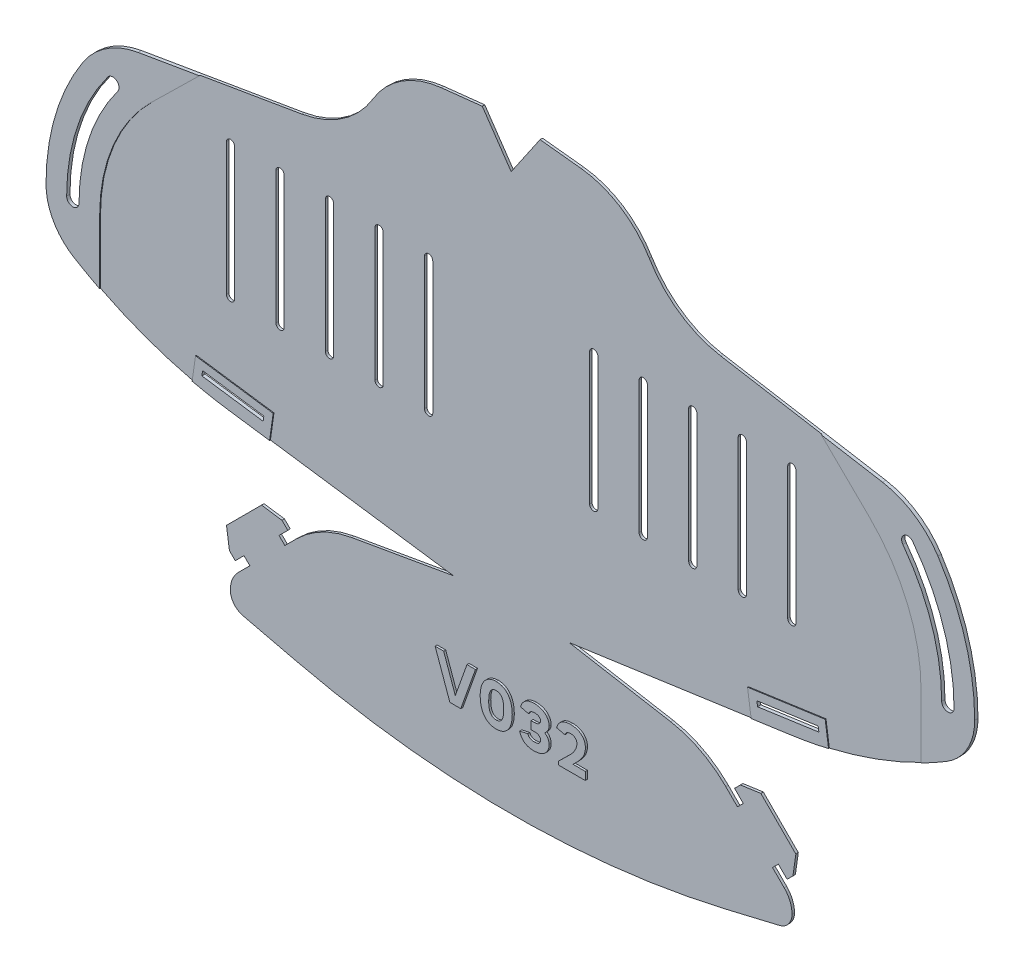
from build123d import *

# Parameters (mm, degrees)
MAIN_SHAPE_DEPTH                   = 0.6
ELASTIC_ATTACHMENT_POINTS_DEPTH    = 184.525502315
REINFORCED_ATTACHMENT_POINTS_DEPTH = 0.2
TAB_SLITS_DEPTH                    = 184.525502315
REINFORCED_TAB_SLITS_DEPTH         = 0.2
BREATHING_SLITS_DEPTH              = 184.525502315
VERSION_NUMBER_DEPTH               = 0.5


with BuildPart() as part:
    # Sketch1 → Main Shape (new body)
    with BuildSketch(Plane.XY):
        with BuildLine():
            Line((0, -10.235233266), (-7, 0))
            Line((-7, 0), (-16.941855461, -1.076805455))
            ThreePointArc((-16.941855461, -1.076805455), (-26.448172688, -4.42923559), (-33.461443341, -11.669600897))
            ThreePointArc((-33.461443341, -11.669600897), (-40.804108255, -19.481824954), (-50.74391922, -23.5))
            Line((-50.74391922, -23.5), (-90.180351554, -30.190874742))
            ThreePointArc((-90.180351554, -30.190874742), (-97.811505455, -33.190405434), (-103.597722286, -39))
            ThreePointArc((-103.597722286, -39), (-110.227482046, -53.35351039), (-112.5, -69))
            ThreePointArc((-112.5, -69), (-110.685143325, -75.893640703), (-105.711102551, -81))
            ThreePointArc((-105.711102551, -81), (-87.655491519, -89.524485559), (-68.266232563, -94.291935705))
            Line((-68.266232563, -94.291935705), (-14, -102))
            Line((-14, -102), (-38.626554922, -106.304973016))
            ThreePointArc((-38.626554922, -106.304973016), (-45.849449199, -108.748014338), (-52, -113.254607005))
            Line((-52, -113.254607005), (-54.828307349, -116.0831539))
            Line((-54.828307349, -116.0831539), (-56.242580797, -114.669000226))
            Line((-56.242580797, -114.669000226), (-54.121350285, -112.547590054))
            Line((-54.121350285, -112.547590054), (-55.535623732, -111.13343638))
            Line((-55.535623732, -111.13343638), (-60.48540114, -110.426539202))
            Line((-60.48540114, -110.426539202), (-68.970323187, -118.912179887))
            Line((-68.970323187, -118.912179887), (-68.263006804, -123.861897408))
            Line((-68.263006804, -123.861897408), (-66.848733357, -125.276051082))
            Line((-66.848733357, -125.276051082), (-64.727502845, -123.154640911))
            Line((-64.727502845, -123.154640911), (-63.313229397, -124.568794586))
            Line((-63.313229397, -124.568794586), (-66.141536747, -127.397341481))
            ThreePointArc((-66.141536747, -127.397341481), (-67.550417669, -129.506025763), (-68.045148042, -131.993340924))
            ThreePointArc((-68.045148042, -131.993340924), (-67.183295285, -134.473669911), (-64.9691321, -135.885159709))
            Line((-64.9691321, -135.885159709), (-52.436095294, -138.860716087))
            ThreePointArc((-52.436095294, -138.860716087), (-26.397134772, -143.459954927), (0, -145))
            ThreePointArc((0, -145), (26.397134772, -143.459954927), (52.436095294, -138.860716087))
            Line((52.436095294, -138.860716087), (64.9691321, -135.885159709))
            ThreePointArc((64.9691321, -135.885159709), (67.183295285, -134.473669911), (68.045148042, -131.993340924))
            ThreePointArc((68.045148042, -131.993340924), (67.550417669, -129.506025763), (66.141536747, -127.397341481))
            Line((66.141536747, -127.397341481), (63.313229397, -124.568794586))
            Line((63.313229397, -124.568794586), (64.727502845, -123.154640911))
            Line((64.727502845, -123.154640911), (66.848733357, -125.276051082))
            Line((66.848733357, -125.276051082), (68.263006804, -123.861897408))
            Line((68.263006804, -123.861897408), (68.970323187, -118.912179887))
            Line((68.970323187, -118.912179887), (60.48540114, -110.426539202))
            Line((60.48540114, -110.426539202), (55.535623732, -111.13343638))
            Line((55.535623732, -111.13343638), (54.121350285, -112.547590054))
            Line((54.121350285, -112.547590054), (56.242580797, -114.669000226))
            Line((56.242580797, -114.669000226), (54.828307349, -116.0831539))
            Line((54.828307349, -116.0831539), (52, -113.254607005))
            ThreePointArc((52, -113.254607005), (45.849449199, -108.748014338), (38.626554922, -106.304973016))
            Line((38.626554922, -106.304973016), (14, -102))
            Line((14, -102), (68.266232563, -94.291935705))
            ThreePointArc((68.266232563, -94.291935705), (87.655491519, -89.524485559), (105.711102551, -81))
            ThreePointArc((105.711102551, -81), (110.685143325, -75.893640703), (112.5, -69))
            ThreePointArc((112.5, -69), (110.227482046, -53.35351039), (103.597722286, -39))
            ThreePointArc((103.597722286, -39), (97.811505455, -33.190405434), (90.180351554, -30.190874742))
            Line((90.180351554, -30.190874742), (50.74391922, -23.5))
            ThreePointArc((50.74391922, -23.5), (40.804108255, -19.481824954), (33.461443341, -11.669600897))
            ThreePointArc((33.461443341, -11.669600897), (26.448172688, -4.42923559), (16.941855461, -1.076805455))
            Line((16.941855461, -1.076805455), (7, 0))
            Line((7, 0), (0, -10.235233266))
        make_face()
    extrude(amount=MAIN_SHAPE_DEPTH)

    # Sketch2 → Elastic Attachment Points (cut, through all)
    with BuildSketch(Plane.XY.offset(0.6)):
        with BuildLine():
            ThreePointArc((-97.5, -39), (-104.934164903, -53.188611699), (-107.5, -69))
            ThreePointArc((-107.5, -69), (-106, -70.5), (-104.5, -69))
            ThreePointArc((-104.5, -69), (-102.088115008, -54.137294997), (-95.1, -40.8))
            ThreePointArc((-95.1, -40.8), (-95.4, -38.7), (-97.5, -39))
        make_face()
        with BuildLine():
            ThreePointArc((97.5, -39), (104.934164903, -53.188611699), (107.5, -69))
            ThreePointArc((107.5, -69), (106, -70.5), (104.5, -69))
            ThreePointArc((104.5, -69), (102.088115008, -54.137294997), (95.1, -40.8))
            ThreePointArc((95.1, -40.8), (95.4, -38.7), (97.5, -39))
        make_face()
    extrude(amount=-ELASTIC_ATTACHMENT_POINTS_DEPTH, mode=Mode.SUBTRACT)

    # Sketch7 → Reinforced Attachment Points (add)
    # profile 1 of 2: a face of its own
    with BuildSketch(Plane.XY.offset(0.6)):
        with BuildLine():
            Line((-99.5, -69), (-99.5, -84.438405623))
            ThreePointArc((-99.5, -84.438405623), (-102.636073846, -82.774338486), (-105.711102551, -81))
            ThreePointArc((-105.711102551, -81), (-110.685143325, -75.893640703), (-112.5, -69))
            ThreePointArc((-112.5, -69), (-110.227482046, -53.35351039), (-103.597722286, -39))
            ThreePointArc((-103.597722286, -39), (-97.811505455, -33.190405434), (-90.180351554, -30.190874742))
            Line((-90.180351554, -30.190874742), (-75.331937335, -27.671659038))
            Line((-75.331937335, -27.671659038), (-86.893876913, -39))
            ThreePointArc((-86.893876913, -39), (-96.22042633, -52.729517991), (-99.5, -69))
        make_face()
        with BuildLine():
            ThreePointArc((-107.5, -69), (-106, -70.5), (-104.5, -69))
            ThreePointArc((-104.5, -69), (-102.088115008, -54.137294997), (-95.1, -40.8))
            ThreePointArc((-95.1, -40.8), (-95.4, -38.7), (-97.5, -39))
            ThreePointArc((-97.5, -39), (-104.934164903, -53.188611699), (-107.5, -69))
        make_face(mode=Mode.SUBTRACT)
    # profile 2 of 2: a face of its own
    with BuildSketch(Plane.XY.offset(0.6)):
        with BuildLine():
            Line((75.331937335, -27.671659038), (90.180351554, -30.190874742))
            ThreePointArc((90.180351554, -30.190874742), (97.811505455, -33.190405434), (103.597722286, -39))
            ThreePointArc((103.597722286, -39), (110.227482046, -53.35351039), (112.5, -69))
            ThreePointArc((112.5, -69), (110.685143325, -75.893640703), (105.711102551, -81))
            ThreePointArc((105.711102551, -81), (102.636073846, -82.774338486), (99.5, -84.438405623))
            Line((99.5, -84.438405623), (99.5, -69))
            ThreePointArc((99.5, -69), (96.22042633, -52.729517991), (86.893876913, -39))
            Line((86.893876913, -39), (75.331937335, -27.671659038))
        make_face()
        with BuildLine():
            ThreePointArc((104.5, -69), (106, -70.5), (107.5, -69))
            ThreePointArc((107.5, -69), (104.934164903, -53.188611699), (97.5, -39))
            ThreePointArc((97.5, -39), (95.4, -38.7), (95.1, -40.8))
            ThreePointArc((95.1, -40.8), (102.088115008, -54.137294997), (104.5, -69))
        make_face(mode=Mode.SUBTRACT)
    extrude(amount=REINFORCED_ATTACHMENT_POINTS_DEPTH)

    # Sketch6 → Tab Slits (cut, through all)
    with BuildSketch(Plane.XY.offset(0.6)):
        Polygon((-74.744153432, -90.341688636), (-59.893220219, -92.451139443), (-59.724464154, -91.263064785), (-74.575397367, -89.153613979), align=None)
        Polygon((74.744153432, -90.341688636), (74.575397367, -89.153613979), (59.724464154, -91.263064785), (59.893220219, -92.451139443), align=None)
    extrude(amount=-TAB_SLITS_DEPTH, mode=Mode.SUBTRACT)

    # Sketch9 → Reinforced Tab Slits (add)
    # profile 1 of 2: a face of its own
    with BuildSketch(Plane.XY.offset(0.6)):
        with BuildLine():
            Line((-58.334985952, -95.702586193), (-57.463079618, -89.564200465))
            Line((-57.463079618, -89.564200465), (-76.274261688, -86.892229443))
            Line((-76.274261688, -86.892229443), (-77.089489456, -92.631587333))
            ThreePointArc((-77.089489456, -92.631587333), (-72.696503913, -93.560831767), (-68.266232563, -94.291935705))
            Line((-68.266232563, -94.291935705), (-58.334985952, -95.702586193))
        make_face()
        Polygon((-59.893220219, -92.451139443), (-59.724464154, -91.263064785), (-74.575397367, -89.153613979), (-74.744153432, -90.341688636), align=None, mode=Mode.SUBTRACT)
    # profile 2 of 2: a face of its own
    with BuildSketch(Plane.XY.offset(0.6)):
        with BuildLine():
            Line((68.266232563, -94.291935705), (58.334985952, -95.702586193))
            Line((58.334985952, -95.702586193), (57.463079618, -89.564200465))
            Line((57.463079618, -89.564200465), (76.274261688, -86.892229443))
            Line((76.274261688, -86.892229443), (77.089489456, -92.631587333))
            ThreePointArc((77.089489456, -92.631587333), (72.696503913, -93.560831767), (68.266232563, -94.291935705))
        make_face()
        Polygon((59.724464154, -91.263064785), (74.575397367, -89.153613979), (74.744153432, -90.341688636), (59.893220219, -92.451139443), align=None, mode=Mode.SUBTRACT)
    extrude(amount=REINFORCED_TAB_SLITS_DEPTH)

    # Sketch3 → Breathing Slits (cut, through all)
    with BuildSketch(Plane.XY.offset(0.6)):
        with BuildLine():
            Line((-19, -38.45), (-19, -70.45))
            ThreePointArc((-19, -70.45), (-20, -71.45), (-21, -70.45))
            Line((-21, -70.45), (-21, -38.45))
            ThreePointArc((-21, -38.45), (-20, -37.45), (-19, -38.45))
        make_face()
        with BuildLine():
            Line((-31, -38.45), (-31, -70.45))
            ThreePointArc((-31, -70.45), (-32, -71.45), (-33, -70.45))
            Line((-33, -70.45), (-33, -38.45))
            ThreePointArc((-33, -38.45), (-32, -37.45), (-31, -38.45))
        make_face()
        with BuildLine():
            Line((-43, -38.45), (-43, -70.45))
            ThreePointArc((-43, -70.45), (-44, -71.45), (-45, -70.45))
            Line((-45, -70.45), (-45, -38.45))
            ThreePointArc((-45, -38.45), (-44, -37.45), (-43, -38.45))
        make_face()
        with BuildLine():
            Line((-55, -38.45), (-55, -70.45))
            ThreePointArc((-55, -70.45), (-56, -71.45), (-57, -70.45))
            Line((-57, -70.45), (-57, -38.45))
            ThreePointArc((-57, -38.45), (-56, -37.45), (-55, -38.45))
        make_face()
        with BuildLine():
            Line((-67, -38.45), (-67, -70.45))
            ThreePointArc((-67, -70.45), (-68, -71.45), (-69, -70.45))
            Line((-69, -70.45), (-69, -38.45))
            ThreePointArc((-69, -38.45), (-68, -37.45), (-67, -38.45))
        make_face()
        with BuildLine():
            Line((19, -38.45), (19, -70.45))
            ThreePointArc((19, -70.45), (20, -71.45), (21, -70.45))
            Line((21, -70.45), (21, -38.45))
            ThreePointArc((21, -38.45), (20, -37.45), (19, -38.45))
        make_face()
        with BuildLine():
            Line((31, -38.45), (31, -70.45))
            ThreePointArc((31, -70.45), (32, -71.45), (33, -70.45))
            Line((33, -70.45), (33, -38.45))
            ThreePointArc((33, -38.45), (32, -37.45), (31, -38.45))
        make_face()
        with BuildLine():
            Line((43, -38.45), (43, -70.45))
            ThreePointArc((43, -70.45), (44, -71.45), (45, -70.45))
            Line((45, -70.45), (45, -38.45))
            ThreePointArc((45, -38.45), (44, -37.45), (43, -38.45))
        make_face()
        with BuildLine():
            Line((55, -38.45), (55, -70.45))
            ThreePointArc((55, -70.45), (56, -71.45), (57, -70.45))
            Line((57, -70.45), (57, -38.45))
            ThreePointArc((57, -38.45), (56, -37.45), (55, -38.45))
        make_face()
        with BuildLine():
            Line((67, -38.45), (67, -70.45))
            ThreePointArc((67, -70.45), (68, -71.45), (69, -70.45))
            Line((69, -70.45), (69, -38.45))
            ThreePointArc((69, -38.45), (68, -37.45), (67, -38.45))
        make_face()
    extrude(amount=-BREATHING_SLITS_DEPTH, mode=Mode.SUBTRACT)

    # Sketch8 → Version Number (add)
    # profile 1 of 4: a face of its own
    with BuildSketch(Plane.XY.offset(0.6)):
        Polygon((-14.353036684, -128.5), (-11.718116049, -128.5), (-8.146687478, -118.5), (-10.210179541, -118.5), (-13.035576367, -126.420634921), (-15.860973192, -118.5), (-17.924465256, -118.5), align=None)
    # profile 2 of 4: a face of its own
    with BuildSketch(Plane.XY.offset(0.6)):
        with BuildLine():
            add(Edge.make_bspline(
                [(-3.124512798, -118.5), (-3.268878762, -118.505695671), (-3.55163391, -118.51685121), (-3.964768911, -118.5745591), (-4.352611614, -118.680335178), (-4.71981319, -118.819656178), (-5.062088761, -119.003303471), (-5.385881936, -119.221085059), (-5.678892551, -119.487440084), (-5.954347604, -119.785519386), (-6.200210785, -120.12453761), (-6.413646494, -120.500892889), (-6.595609271, -120.912503383), (-6.744530434, -121.360169436), (-6.860079483, -121.844506854), (-6.947833422, -122.364485904), (-6.999387861, -122.921030718), (-7.010044591, -123.303893775), (-7.015523173, -123.500722112)],
                knots=[0, 0, 0, 0, 0.970159994, 1.900155169, 2.79438565, 3.665191596, 4.532301255, 5.397946305, 6.279238358, 7.185391655, 8.120220805, 9.085107467, 10.08639026, 11.138349125, 12.249459105, 13.427760297, 14.677622047, 16, 16, 16, 16], degree=3))
            add(Edge.make_bspline(
                [(-7.015523173, -123.500722112), (-7.010099782, -123.69832053), (-6.999591155, -124.081196856), (-6.947624086, -124.637697099), (-6.860178196, -125.156966907), (-6.744068339, -125.641884177), (-6.596125676, -126.090648826), (-6.413579051, -126.502814664), (-6.200268747, -126.879260377), (-5.954187566, -127.218032326), (-5.679795829, -127.51659595), (-5.384328283, -127.779877259), (-5.06297704, -128.000979952), (-4.719619736, -128.183632701), (-4.353066681, -128.324409639), (-3.964113602, -128.425104033), (-3.552335281, -128.488808035), (-3.269553908, -128.496221224), (-3.125409832, -128.5)],
                knots=[0, 0, 0, 0, 1.327400251, 2.57203543, 3.750234214, 4.861247624, 5.917991082, 6.919186852, 7.883989653, 8.818737555, 9.724812096, 10.602616666, 11.47109776, 12.338132057, 13.208862319, 14.101698703, 15.032365954, 16, 16, 16, 16], degree=3))
            add(Edge.make_bspline(
                [(-3.125409832, -128.5), (-2.981270164, -128.496210687), (-2.698497434, -128.488776824), (-2.28665702, -128.425221319), (-1.897234689, -128.323813307), (-1.529873211, -128.184839888), (-1.187483731, -128.000200623), (-0.866437325, -127.779984633), (-0.571038656, -127.516566079), (-0.296628857, -127.218040576), (-0.05054823, -126.879258594), (0.162744512, -126.502813072), (0.345366389, -126.090657611), (0.493004127, -125.641847927), (0.610316977, -125.157235462), (0.692759124, -124.637275213), (0.750415349, -124.081441513), (0.758325717, -123.698369528), (0.762407101, -123.500722112)],
                knots=[0, 0, 0, 0, 0.96765053, 1.898333634, 2.791185227, 3.666728435, 4.529238626, 5.397734515, 6.275554038, 7.181644014, 8.116407839, 9.081227075, 10.082439899, 11.139201358, 12.250233695, 13.427610983, 14.672766316, 16, 16, 16, 16], degree=3))
            add(Edge.make_bspline(
                [(0.762407101, -123.500722112), (0.758266271, -123.303845261), (0.750209566, -122.920787111), (0.692965588, -122.364907693), (0.610217393, -121.844238468), (0.493467757, -121.360205444), (0.344849792, -120.912494629), (0.162811975, -120.500894477), (-0.050606202, -120.124539393), (-0.296468797, -119.785511139), (-0.571942034, -119.487469991), (-0.864883242, -119.220977415), (-1.188368104, -119.004075275), (-1.529679752, -118.818455332), (-1.897690316, -118.680915067), (-2.286006948, -118.574534625), (-2.698856026, -118.516562336), (-2.981340857, -118.506550382), (-3.125409832, -118.501444225)],
                knots=[0, 0, 0, 0, 1.322391154, 2.572941942, 3.750582404, 4.861863084, 5.913983562, 6.915420183, 7.880455081, 8.815427849, 9.721720359, 10.603147806, 11.468925845, 12.331628829, 13.207367743, 14.101735605, 15.031873656, 16, 16, 16, 16], degree=3))
            Line((-3.125409832, -118.501444225), (-3.124512798, -118.5))
        make_face()
        with BuildLine():
            add(Edge.make_bspline(
                [(-3.124512798, -126.579365079), (-3.193832346, -126.580142247), (-3.329842672, -126.581667111), (-3.527295909, -126.549518886), (-3.713747004, -126.50001124), (-3.887924299, -126.424863461), (-4.05171966, -126.32888552), (-4.202335203, -126.207295998), (-4.340694226, -126.063513987), (-4.468009284, -125.896932623), (-4.581880587, -125.703005633), (-4.680411576, -125.478827118), (-4.761148991, -125.222713054), (-4.830325749, -124.937433189), (-4.881577114, -124.621763618), (-4.920080679, -124.276117752), (-4.945947343, -123.899148475), (-4.949306618, -123.63702081), (-4.951053342, -123.500722112)],
                knots=[0, 0, 0, 0, 0.820209436, 1.609314487, 2.362064528, 3.101854642, 3.850272983, 4.605479342, 5.3882482, 6.210255141, 7.084711649, 8.047345167, 9.106040688, 10.263495908, 11.523832392, 12.893430008, 14.384674726, 16, 16, 16, 16], degree=3))
            add(Edge.make_bspline(
                [(-4.951053342, -123.500722112), (-4.949299731, -123.364424703), (-4.945927212, -123.102299516), (-4.920151567, -122.725313211), (-4.881258593, -122.378974061), (-4.830962309, -122.063111109), (-4.760744886, -121.778059679), (-4.680441854, -121.522619394), (-4.581911694, -121.298401339), (-4.467877035, -121.104640769), (-4.341486731, -120.937923887), (-4.201524245, -120.796456824), (-4.051803493, -120.674830172), (-3.887963609, -120.578630118), (-3.713317589, -120.50465551), (-3.527950042, -120.450210023), (-3.329806333, -120.423926373), (-3.19436306, -120.422146526), (-3.125409832, -120.421240419)],
                knots=[0, 0, 0, 0, 1.616177311, 3.108208617, 4.478528655, 5.748482895, 6.897727805, 7.956981757, 8.920123036, 9.795040793, 10.617481319, 11.394165711, 12.149770419, 12.898583529, 13.63876386, 14.394368568, 15.182584207, 16, 16, 16, 16], degree=3))
            add(Edge.make_bspline(
                [(-3.125409832, -120.421240419), (-3.056458197, -120.422149219), (-2.921018053, -120.423934355), (-2.722851832, -120.450179948), (-2.537565245, -120.504762296), (-2.363231898, -120.577982734), (-2.201006563, -120.675595023), (-2.051536805, -120.796360516), (-1.911636558, -120.937948802), (-1.785272246, -121.104645093), (-1.671047509, -121.298351736), (-1.573262228, -121.523063414), (-1.48930237, -121.777554553), (-1.420113271, -122.063195246), (-1.369483592, -122.378948588), (-1.330691478, -122.725320897), (-1.304885814, -123.102297333), (-1.301517662, -123.364423957), (-1.299766323, -123.500722112)],
                knots=[0, 0, 0, 0, 0.817669415, 1.606129616, 2.361968767, 3.102378757, 3.843623451, 4.599462602, 5.376387978, 6.199083685, 7.074272906, 8.037713021, 9.100132017, 10.249733507, 11.520081779, 12.89082699, 14.383321233, 16, 16, 16, 16], degree=3))
            add(Edge.make_bspline(
                [(-1.299766323, -123.500722112), (-1.301510776, -123.637021556), (-1.304865684, -123.899150658), (-1.33076236, -124.276110066), (-1.36916531, -124.621789015), (-1.420748529, -124.937349474), (-1.488890394, -125.223220708), (-1.573291906, -125.478383327), (-1.671078761, -125.703055181), (-1.78513994, -125.896928348), (-1.912429082, -126.063488884), (-2.050725173, -126.207393621), (-2.201089262, -126.328120602), (-2.363270489, -126.425517476), (-2.537135739, -126.499891817), (-2.723505077, -126.549600883), (-2.920694706, -126.581404352), (-3.056393241, -126.580608552), (-3.125409832, -126.580203806)],
                knots=[0, 0, 0, 0, 1.616177474, 3.108208932, 4.478529109, 5.739530511, 6.897596372, 7.959685938, 8.922827315, 9.797745161, 10.620185771, 11.403367596, 12.15897238, 12.899987232, 13.640167639, 14.39331481, 15.182836171, 16, 16, 16, 16], degree=3))
            Line((-3.125409832, -126.580203806), (-3.124512798, -126.579365079))
        make_face(mode=Mode.SUBTRACT)
    # profile 3 of 4: a face of its own
    with BuildSketch(Plane.XY.offset(0.6)):
        with BuildLine():
            Line((6.198092009, -124.404761905), (6.293330104, -124.404761905))
            add(Edge.make_bspline(
                [(6.293330104, -124.404761905), (6.393597999, -124.411299477), (6.584233201, -124.423729091), (6.850899497, -124.486416557), (7.083693586, -124.578961335), (7.275380964, -124.709274647), (7.429026265, -124.861365804), (7.543353704, -125.032278467), (7.613014948, -125.222537651), (7.621890385, -125.355662585), (7.626367416, -125.422814713)],
                knots=[0, 0, 0, 0, 1.293250512, 2.458803691, 3.516087315, 4.504014474, 5.424976382, 6.287022232, 7.135923681, 8, 8, 8, 8], degree=3))
            add(Edge.make_bspline(
                [(7.626367416, -125.422814713), (7.623077866, -125.504440638), (7.61671688, -125.662280257), (7.547569508, -125.887718235), (7.429214651, -126.087113891), (7.294298814, -126.23073656), (7.165134159, -126.331172702), (7.050245163, -126.395688771), (6.921394263, -126.450185226), (6.778366257, -126.49595932), (6.621644798, -126.532200484), (6.450685861, -126.560253509), (6.264862139, -126.575366879), (6.136023143, -126.5785552), (6.069403517, -126.580203806)],
                knots=[0, 0, 0, 0, 1.334208421, 2.579951764, 3.816761299, 5.103436918, 5.78324123, 6.491044783, 7.25516555, 8.072210043, 8.94833879, 9.888551629, 10.908219533, 12, 12, 12, 12], degree=3))
            add(Edge.make_bspline(
                [(6.069403517, -126.580203806), (5.995009926, -126.579024673), (5.844525333, -126.576639503), (5.617878787, -126.537785365), (5.389603829, -126.472292557), (5.16250643, -126.384048723), (4.948349829, -126.26078738), (4.771027301, -126.088542309), (4.629857545, -125.87591894), (4.575288391, -125.712337396), (4.546885722, -125.62719493)],
                knots=[0, 0, 0, 0, 0.920255672, 1.861508472, 2.836752399, 3.857684402, 4.873720033, 5.872631744, 6.892727297, 8, 8, 8, 8], degree=3))
            Line((4.546885722, -125.62719493), (2.563171374, -126.071428571))
            add(Edge.make_bspline(
                [(2.563171374, -126.071428571), (2.586006658, -126.160336196), (2.630962803, -126.335369884), (2.723971682, -126.586847228), (2.83540912, -126.824009097), (2.960565463, -127.050933458), (3.10871655, -127.26169635), (3.272885089, -127.459934114), (3.452116619, -127.647890635), (3.652448911, -127.819546753), (3.86989589, -127.976110236), (4.107042463, -128.112422888), (4.361607961, -128.230322428), (4.637145351, -128.322934743), (4.929262966, -128.399729339), (5.240531536, -128.45295857), (5.569362514, -128.491934936), (5.795244006, -128.497268097), (5.910951439, -128.5)],
                knots=[0, 0, 0, 0, 0.97897001, 1.927311989, 2.855460552, 3.773345826, 4.68872018, 5.599601379, 6.518067916, 7.456260856, 8.41049365, 9.372940738, 10.370680865, 11.39871829, 12.470472684, 13.590411754, 14.765692276, 16, 16, 16, 16], degree=3))
            add(Edge.make_bspline(
                [(5.910951439, -128.5), (6.067221325, -128.494245394), (6.369747375, -128.483104934), (6.807556164, -128.435865678), (7.213204546, -128.358387224), (7.586979338, -128.252017359), (7.931853032, -128.123277608), (8.242838452, -127.961059217), (8.524929888, -127.774497038), (8.772583909, -127.55815064), (8.986978622, -127.319870658), (9.178736196, -127.071551477), (9.336525488, -126.805353082), (9.469056142, -126.527874631), (9.567683766, -126.234513517), (9.639147469, -125.928607165), (9.680819871, -125.607680152), (9.685937504, -125.38925418), (9.68854084, -125.278141077)],
                knots=[0, 0, 0, 0, 1.338573179, 2.591371041, 3.766159492, 4.869841347, 5.915366975, 6.911991706, 7.866279139, 8.804635322, 9.718527085, 10.607232931, 11.486170613, 12.362759498, 13.235296616, 14.130311397, 15.048891017, 16, 16, 16, 16], degree=3))
            add(Edge.make_bspline(
                [(9.68854084, -125.278141077), (9.683192413, -125.181448476), (9.672665654, -124.991138356), (9.617350068, -124.713321084), (9.52499018, -124.451246621), (9.395798442, -124.20784025), (9.244598736, -123.977552327), (9.06946732, -123.764837772), (8.875070274, -123.566155092), (8.730645608, -123.449574998), (8.657454128, -123.39049458)],
                knots=[0, 0, 0, 0, 1.042147361, 2.051151675, 3.039496243, 4.024119517, 5.012016893, 6.002285516, 6.987598979, 8, 8, 8, 8], degree=3))
            add(Edge.make_bspline(
                [(8.657454128, -123.39049458), (8.730635163, -123.325162044), (8.874995919, -123.19628365), (9.069268042, -122.981710509), (9.243438747, -122.755542958), (9.396794499, -122.515248899), (9.523996024, -122.261642739), (9.616820113, -121.993228321), (9.672728376, -121.711764564), (9.683213764, -121.519933272), (9.68854084, -121.42247384)],
                knots=[0, 0, 0, 0, 1.026734164, 2.025389794, 3.025877614, 4.013273499, 5.006315215, 5.989929209, 6.978788314, 8, 8, 8, 8], degree=3))
            add(Edge.make_bspline(
                [(9.68854084, -121.42247384), (9.684458975, -121.322020203), (9.676439995, -121.124675201), (9.629497298, -120.835115028), (9.554319283, -120.558271626), (9.446877226, -120.294880847), (9.31346163, -120.042407113), (9.148649716, -119.803370965), (8.957620538, -119.574583887), (8.736789679, -119.361344215), (8.490090521, -119.166999953), (8.218282305, -118.995833154), (7.923743615, -118.84746887), (7.602967562, -118.730513446), (7.261051945, -118.632405283), (6.895172109, -118.562780212), (6.506096954, -118.515976725), (6.238708863, -118.506371293), (6.101553214, -118.501444225)],
                knots=[0, 0, 0, 0, 0.933249724, 1.833404674, 2.71837752, 3.592513965, 4.4704886, 5.365912677, 6.284554944, 7.234984132, 8.212272519, 9.196674926, 10.214289296, 11.269589965, 12.363543901, 13.515449053, 14.72555956, 16, 16, 16, 16], degree=3))
            add(Edge.make_bspline(
                [(6.101553214, -118.501444225), (5.988160862, -118.504384419), (5.766980103, -118.510119502), (5.444195833, -118.546209564), (5.138366528, -118.597359567), (4.849547802, -118.671164203), (4.578504245, -118.76520159), (4.324782162, -118.877770477), (4.088252628, -119.009217236), (3.870649359, -119.161041577), (3.670388783, -119.328960798), (3.488991795, -119.510905494), (3.324244802, -119.704452098), (3.179710626, -119.91288512), (3.05008115, -120.132286581), (2.943546121, -120.36651166), (2.848627163, -120.610059019), (2.805222945, -120.780460499), (2.7832452, -120.866743363)],
                knots=[0, 0, 0, 0, 1.229240767, 2.397731417, 3.51786287, 4.588673614, 5.625367482, 6.624717489, 7.594406979, 8.554388623, 9.496885304, 10.424058211, 11.336820069, 12.248524965, 13.170856983, 14.095351914, 15.035580601, 16, 16, 16, 16], degree=3))
            Line((2.7832452, -120.866743363), (4.690155501, -121.373015873))
            add(Edge.make_bspline(
                [(4.690155501, -121.373015873), (4.701453151, -121.326631527), (4.725969327, -121.22597637), (4.816470454, -121.081457089), (4.938319128, -120.927147787), (5.099531903, -120.771324055), (5.296909676, -120.625559671), (5.534999654, -120.514206488), (5.808084041, -120.446844288), (6.000913479, -120.430020784), (6.101553214, -120.421240419)],
                knots=[0, 0, 0, 0, 0.626586808, 1.359708585, 2.222843852, 3.223153095, 4.308434095, 5.447412619, 6.667777482, 8, 8, 8, 8], degree=3))
            add(Edge.make_bspline(
                [(6.101553214, -120.421240419), (6.1735862, -120.423218633), (6.311821689, -120.42701494), (6.509225011, -120.449676308), (6.689516639, -120.474391788), (6.850566044, -120.515621967), (6.996181051, -120.558109891), (7.120790238, -120.618078056), (7.231551572, -120.680273756), (7.34645526, -120.780934624), (7.460783251, -120.912654377), (7.563777203, -121.077310889), (7.623774218, -121.24921056), (7.625513286, -121.365405566), (7.626367416, -121.42247384)],
                knots=[0, 0, 0, 0, 1.26888152, 2.435057415, 3.499383416, 4.470882074, 5.362320585, 6.164854387, 6.902680001, 7.591682225, 8.843898063, 9.963361673, 10.999720905, 12, 12, 12, 12], degree=3))
            add(Edge.make_bspline(
                [(7.626367416, -121.42247384), (7.621296662, -121.49199044), (7.611218464, -121.630155711), (7.535939651, -121.827940252), (7.414414338, -122.008163808), (7.251087592, -122.171288708), (7.043751683, -122.307565764), (6.796214708, -122.408872593), (6.509334374, -122.47003825), (6.305479531, -122.480300003), (6.198002305, -122.485710249)],
                knots=[0, 0, 0, 0, 0.842573162, 1.674626639, 2.532888499, 3.465967991, 4.458251597, 5.524776888, 6.695002246, 8, 8, 8, 8], degree=3))
            Line((6.198002305, -122.485710249), (5.340949152, -122.484126984))
            Line((5.340949152, -122.484126984), (5.340949152, -124.404761905))
            Line((5.340949152, -124.404761905), (6.198092009, -124.404761905))
        make_face()
    # profile 4 of 4: a face of its own
    with BuildSketch(Plane.XY.offset(0.6)):
        with BuildLine():
            Line((18.448978951, -126.579365079), (15.480724983, -126.579365079))
            Line((15.480724983, -126.579365079), (16.480724983, -125.579365079))
            add(Edge.make_bspline(
                [(16.480724983, -125.579365079), (16.623258002, -125.435101948), (16.904512687, -125.150433303), (17.281272668, -124.693877148), (17.621400807, -124.228877799), (17.872007262, -123.829278657), (18.04550508, -123.500008431), (18.15843927, -123.246183665), (18.255245955, -122.984860872), (18.332745009, -122.715154547), (18.395353852, -122.438403207), (18.440454661, -122.153805288), (18.471903881, -121.861768592), (18.476743782, -121.664444299), (18.47918657, -121.56485107)],
                knots=[0, 0, 0, 0, 1.582570997, 3.122823812, 4.615792444, 6.07845684, 6.800172901, 7.519807657, 8.24584061, 8.973961103, 9.709013445, 10.459618703, 11.222541005, 12, 12, 12, 12], degree=3))
            add(Edge.make_bspline(
                [(18.47918657, -121.56485107), (18.475402354, -121.452127389), (18.468004607, -121.231764352), (18.417721279, -120.911326598), (18.343669655, -120.60713083), (18.23385907, -120.321563977), (18.098584864, -120.051733691), (17.93409097, -119.798158257), (17.737813947, -119.564341147), (17.51452569, -119.348254557), (17.266563933, -119.152664175), (16.993827184, -118.982193794), (16.698250561, -118.837069135), (16.380317292, -118.718460118), (16.040320278, -118.622746198), (15.677025045, -118.559191945), (15.292116265, -118.513486883), (15.02782753, -118.505528391), (14.892198944, -118.501444225)],
                knots=[0, 0, 0, 0, 1.019764297, 1.993532827, 2.929308438, 3.84787678, 4.755541458, 5.656627231, 6.576344045, 7.511991459, 8.464008606, 9.428817176, 10.417039143, 11.438566378, 12.495688184, 13.60842439, 14.772683148, 16, 16, 16, 16], degree=3))
            add(Edge.make_bspline(
                [(14.892198944, -118.501444225), (14.776550388, -118.504731189), (14.550181839, -118.511165039), (14.22006676, -118.542535978), (13.908055792, -118.596276475), (13.614145925, -118.665774953), (13.33888903, -118.757886794), (13.082905875, -118.871562794), (12.84373399, -119.001342713), (12.623752457, -119.151574984), (12.424559103, -119.320801377), (12.239491976, -119.500802902), (12.077215107, -119.698408314), (11.927009036, -119.905748922), (11.800344394, -120.130971141), (11.689213195, -120.368710981), (11.596403087, -120.619826819), (11.550985906, -120.794348677), (11.527962791, -120.882818212)],
                knots=[0, 0, 0, 0, 1.237288182, 2.421847195, 3.543086451, 4.621383684, 5.649265595, 6.642689818, 7.613694239, 8.55614632, 9.485995527, 10.406534234, 11.313316084, 12.217506806, 13.141643155, 14.072032899, 15.02266482, 16, 16, 16, 16], degree=3))
            Line((11.527962791, -120.882818212), (13.512471015, -121.373015873))
            add(Edge.make_bspline(
                [(13.512471015, -121.373015873), (13.530131457, -121.313660818), (13.566007253, -121.193085709), (13.660731999, -121.024273028), (13.78838454, -120.866109379), (13.944766698, -120.716952615), (14.136551961, -120.59002378), (14.360902976, -120.494492671), (14.617096311, -120.438465619), (14.797774531, -120.427152683), (14.892198944, -120.421240419)],
                knots=[0, 0, 0, 0, 0.821603693, 1.669023057, 2.553015954, 3.518058165, 4.53170708, 5.594421511, 6.742818376, 8, 8, 8, 8], degree=3))
            add(Edge.make_bspline(
                [(14.892198944, -120.421240419), (15.005870609, -120.426106911), (15.22247777, -120.43538026), (15.527445392, -120.504263654), (15.792364131, -120.616865119), (16.014713601, -120.772700105), (16.191294293, -120.965209606), (16.321914784, -121.190228557), (16.401550566, -121.447139154), (16.411752324, -121.629344082), (16.417013146, -121.723303148)],
                knots=[0, 0, 0, 0, 1.208719883, 2.30327744, 3.306415015, 4.253218101, 5.169797949, 6.063846763, 7.001568439, 8, 8, 8, 8], degree=3))
            add(Edge.make_bspline(
                [(16.417013146, -121.723303148), (16.414388747, -121.841534164), (16.408974023, -122.085471261), (16.331326003, -122.456607682), (16.210725288, -122.843397809), (16.070407917, -123.172040038), (15.933218998, -123.443264128), (15.808214918, -123.651697293), (15.667380025, -123.86351308), (15.510811575, -124.079317691), (15.338408545, -124.300506253), (15.147810225, -124.52439598), (14.941286452, -124.75288648), (14.793330453, -124.901378986), (14.717672017, -124.977311769)],
                knots=[0, 0, 0, 0, 1.128055105, 2.32743062, 3.606916281, 4.996817725, 5.736192845, 6.510253921, 7.317743928, 8.166429697, 9.057590288, 9.997041475, 10.975771781, 12, 12, 12, 12], degree=3))
            Line((14.717672017, -124.977311769), (11.988661491, -127.642857143))
            Line((11.988661491, -127.642857143), (11.988661491, -128.5))
            Line((11.988661491, -128.5), (18.448978951, -128.5))
            Line((18.448978951, -128.5), (18.448978951, -126.579365079))
        make_face()
    extrude(amount=VERSION_NUMBER_DEPTH)


solid = part.part
